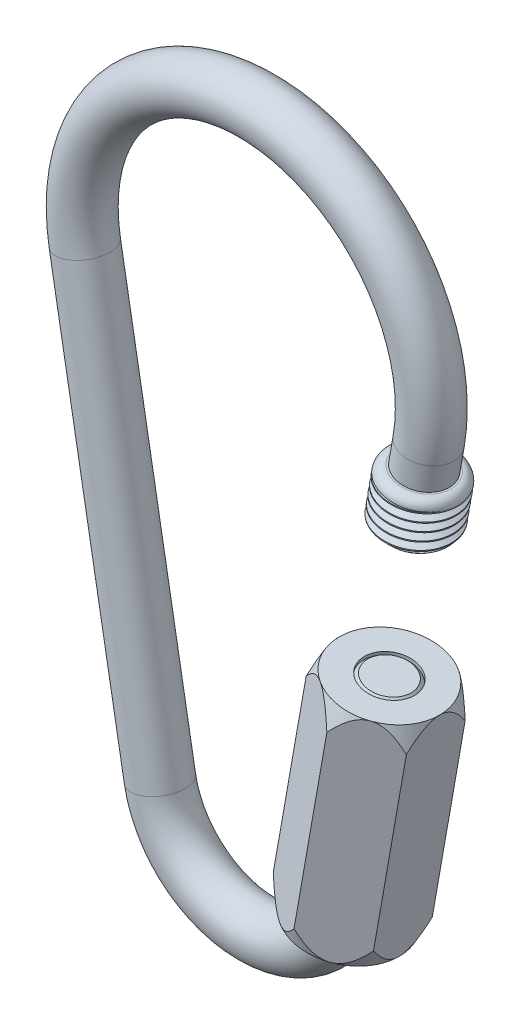
from build123d import *
from build123d.topology import SkipClean

# Parameters (mm, degrees)
SKETCH2_R           = 1.75
SKETCH5_R           = 1.75
BOSS_EXTRUDE1_DEPTH = 16
SKETCH6_OUTSIDE_W   = 75.065
SKETCH6_OUTSIDE_H   = 46.828
SKETCH6_OUTSIDE_R   = 3.5
CUT_EXTRUDE1_DEPTH  = 34.030392312
CUT_EXTRUDE1_DRAFT  = -20
SKETCH7_OUTSIDE_W   = 86.345
SKETCH7_OUTSIDE_H   = 58.108
SKETCH7_OUTSIDE_R   = 3.5
CUT_EXTRUDE2_DEPTH  = 49.525353364
CUT_EXTRUDE2_DRAFT  = -20
CHAMFER1_SIZE       = 0.46875
CHAMFER2_SIZE       = 0.234375
CUT_SWEEP1_PITCH    = 0.625


with BuildPart() as part:
    # Sweep1: sweep along a path in Sketch3
    with BuildLine(Plane.XY) as sweep1_path:
        Line((10.844147929, -5.191458855), (8.371007434, -19.225206612))
        ThreePointArc((8.371007434, -19.225206612), (0, -26.25), (-8.371007434, -19.225206612))
        Line((-8.371007434, -19.225206612), (-13.541335554, 10.113636364))
        ThreePointArc((-13.541335554, 10.113636364), (0, 26.25), (13.541335554, 10.113636364))
        Line((13.541335554, 10.113636364), (12.57968512, 4.656785184))
    # Sketch2 → Sweep1 (sweep)
    with BuildSketch(Plane(origin=(0, 0, 0), x_dir=(0, 0, -1), z_dir=(1, 0, 0))):
        with Locations((0, 24.5)):
            Circle(SKETCH2_R)
    sweep(path=sweep1_path.line)

    # Sketch4 → Revolve1 (revolve)
    with BuildSketch(Plane.XY):
        with BuildLine():
            Line((13.360719597, 8.368499442), (11.514173839, 8.693912665))
            Line((11.514173839, 8.693912665), (10.856242413, 4.960504193))
            Line((10.856242413, 4.960504193), (13.318303423, 4.526619895))
            Line((13.318303423, 4.526619895), (13.867763775, 7.644513115))
            ThreePointArc((13.867763775, 7.644513115), (13.764184163, 8.111518566), (13.360719597, 8.368499442))
        make_face()
    revolve(axis=Axis((10.856242413, 4.960504193, 0), (0.17355371900826358, 0.9848244039514865, 0)))

    # Chamfer1
    chamfer1_edges = [part.edges().sort_by_distance(p)[0] for p in [
        (8.394181403, 5.39438849, 0),
    ]]
    chamfer(chamfer1_edges, length=CHAMFER1_SIZE)

    # Chamfer2
    chamfer2_edges = [part.edges().sort_by_distance(p)[0] for p in [
        (9.120705223, -4.887739847, 1.75),
    ]]
    chamfer(chamfer2_edges, length=CHAMFER2_SIZE)

    # Cut-Sweep1: the profile of Sketch8 screwed along a right-hand helix of 7.065501 turns, 6 arcs to a turn; built about Z, then put on its axis
    cut_sweep1_z = Axis((0, 0, 0), (0, 0, 1))
    cut_sweep1_corners = [(2.533829117, 0, 0.01953125), (2.533829117, 0, -0.56640625), (2.094050592, 0, -0.3125), (2.094050592, 0, -0.234375)]
    with BuildLine(mode=Mode.PRIVATE) as cut_sweep1_profile:
        Line(cut_sweep1_corners[0], cut_sweep1_corners[1])
        Line(cut_sweep1_corners[1], cut_sweep1_corners[2])
        Line(cut_sweep1_corners[2], cut_sweep1_corners[3])
        Line(cut_sweep1_corners[3], cut_sweep1_corners[0])
    cut_sweep1_cap = Face(cut_sweep1_profile.wire())
    cut_sweep1_turn_angles = [0, 30, 60, 90, 120, 150, 180, 210, 240, 270, 300, 330, 360]
    cut_sweep1_turn_weights = [1, 0.8660254037844387, 1, 0.8660254037844387, 1, 0.8660254037844387, 1, 0.8660254037844387, 1, 0.8660254037844387, 1, 0.8660254037844387, 1]
    cut_sweep1_turn_rails = [Edge.make_bspline([Vector(p[0], p[1], 0).rotate(cut_sweep1_z, cut_sweep1_turn_angles[k]) / cut_sweep1_turn_weights[k] + Vector(0, 0, p[2] + CUT_SWEEP1_PITCH * cut_sweep1_turn_angles[k] / 360) for k in range(13)], [0, 0, 0, 1, 1, 2, 2, 3, 3, 4, 4, 5, 5, 6, 6, 6], 2, cut_sweep1_turn_weights) for p in cut_sweep1_corners]
    cut_sweep1_turn_sides = [Face.make_surface_from_curves(cut_sweep1_turn_rails[p[0]], cut_sweep1_turn_rails[p[1]]) for p in [(0, 1), (1, 2), (2, 3), (3, 0)]]
    cut_sweep1_last_angles = [2520, 2531.790207214, 2543.580414429]
    cut_sweep1_last_weights = [1, 0.978902326183202, 1]
    cut_sweep1_last_rails = [Edge.make_bspline([Vector(p[0], p[1], 0).rotate(cut_sweep1_z, cut_sweep1_last_angles[k]) / cut_sweep1_last_weights[k] + Vector(0, 0, p[2] + CUT_SWEEP1_PITCH * cut_sweep1_last_angles[k] / 360) for k in range(3)], [0, 0, 0, 1, 1, 1], 2, cut_sweep1_last_weights) for p in cut_sweep1_corners]
    cut_sweep1_last_sides = [Face.make_surface_from_curves(cut_sweep1_last_rails[p[0]], cut_sweep1_last_rails[p[1]]) for p in [(0, 1), (1, 2), (2, 3), (3, 0)]]
    cut_sweep1 = Plane(origin=(10.856242413, 4.960504193, 0), x_dir=(0.9848244039514862, -0.17355371900826594, 0), z_dir=(0.17355371900826594, 0.9848244039514862, 0)) * Solid(Shell([*[p.moved(Location((0, 0, CUT_SWEEP1_PITCH * i))) for i in range(7) for p in cut_sweep1_turn_sides], *cut_sweep1_last_sides, cut_sweep1_cap, cut_sweep1_cap.rotate(cut_sweep1_z, 2543.580414429).moved(Location((0, 0, CUT_SWEEP1_PITCH * 2543.580414429 / 360)))]))
    add(cut_sweep1, mode=Mode.SUBTRACT)

    # Sketch10 → Revolve2 (revolve)
    with SkipClean():  # the faces are left unmerged after this step: merging them gives an invalid solid
        with BuildSketch(Plane.XY):
            with BuildLine():
                Line((11.514173839, 8.693912665), (13.360719597, 8.368499442))
                ThreePointArc((13.360719597, 8.368499442), (13.764184163, 8.111518566), (13.867763775, 7.644513115))
                Line((13.867763775, 7.644513115), (11.405702765, 8.078397413))
                Line((11.405702765, 8.078397413), (11.514173839, 8.693912665))
            make_face()
        revolve(axis=Axis((10.856242413, 4.960504193, 0), (0.17355371900826358, 0.9848244039514865, 0)))


with BuildPart() as body_2:
    # Sketch5 → Boss-Extrude1 (new body)
    with BuildSketch(Plane(origin=(-0.560688401, -3.181606386, 0), x_dir=(0.9848244039514864, -0.1735537190082649, 0), z_dir=(0.1735537190082649, 0.9848244039514864, 0))):
        Polygon((6.330578512, -2.020725942), (9.830578512, -4.041451884), (13.330578512, -2.020725942), (13.330578512, 2.020725942), (9.830578512, 4.041451884), (6.330578512, 2.020725942), align=None)
        with Locations(Location((9.830578512, 0, 0), (0, 0, 180))):
            Circle(SKETCH5_R, mode=Mode.SUBTRACT)
    extrude(amount=-BOSS_EXTRUDE1_DEPTH)


with BuildPart() as cut_extrude1_tool:
    # Sketch6 outside → Cut-Extrude1 (with draft: the straight prism first)
    with BuildSketch(Plane(origin=(-0.560688401, -3.181606386, 0), x_dir=(0.9848244039514863, -0.1735537190082648, 0), z_dir=(0.1735537190082648, 0.9848244039514863, 0))):
        with Locations((0.0625, 0)):
            Rectangle(SKETCH6_OUTSIDE_W, SKETCH6_OUTSIDE_H)
        with Locations((9.830578512, 0)):
            Circle(SKETCH6_OUTSIDE_R, mode=Mode.SUBTRACT)
    extrude(amount=-CUT_EXTRUDE1_DEPTH)
    # Cut-Extrude1: the draft: its side faces are tilted about the plane it starts from
    cut_extrude1_sides = [cut_extrude1_tool.faces().sort_by_distance(p)[0] for p in [
        (-3.452187449, -19.949433906, 23.414),
        (33.510734493, -26.463338865, 0),
        (-3.452187449, -19.949433906, -23.414),
        (-40.41510939, -13.435528948, 0),
        (2.720769236, -21.037282243, 0),
    ]]
    draft(cut_extrude1_sides, Plane(origin=(-0.560688401, -3.181606386, 0), x_dir=(0.9848244039514863, -0.1735537190082648, 0), z_dir=(0.1735537190082648, 0.9848244039514863, 0)), CUT_EXTRUDE1_DRAFT)


with BuildPart() as body_2_1:
    add(body_2.part)

    # Cut-Extrude1: cut by cut_extrude1_tool
    add(cut_extrude1_tool.part, mode=Mode.SUBTRACT)


with BuildPart() as cut_extrude2_tool:
    # Sketch7 outside → Cut-Extrude2 (with draft: the straight prism first)
    with BuildSketch(Plane(origin=(-3.337547906, -18.938796849, 0), x_dir=(0.9848244039514863, -0.1735537190082648, 0), z_dir=(-0.1735537190082648, -0.9848244039514863, 0))):
        with Locations((0.0625, 0)):
            Rectangle(SKETCH7_OUTSIDE_W, SKETCH7_OUTSIDE_H)
        with Locations((9.830578512, 0)):
            Circle(SKETCH7_OUTSIDE_R, mode=Mode.SUBTRACT)
    extrude(amount=-CUT_EXTRUDE2_DEPTH)
    # Cut-Extrude2: the draft: its side faces are tilted about the plane it starts from
    cut_extrude2_sides = [cut_extrude2_tool.faces().sort_by_distance(p)[0] for p in [
        (1.02165825, 5.437244347, -29.054),
        (43.53898983, -2.055503587, 0),
        (1.02165825, 5.437244347, 29.054),
        (-41.495673329, 12.929992281, 0),
        (7.194614935, 4.34939601, 0),
    ]]
    draft(cut_extrude2_sides, Plane(origin=(-3.337547906, -18.938796849, 0), x_dir=(0.9848244039514863, -0.1735537190082648, 0), z_dir=(-0.1735537190082648, -0.9848244039514863, 0)), CUT_EXTRUDE2_DRAFT)


with BuildPart() as body_2_2:
    add(body_2_1.part)

    # Cut-Extrude2: cut by cut_extrude2_tool
    add(cut_extrude2_tool.part, mode=Mode.SUBTRACT)


solid = Compound([part.part, body_2_2.part])
